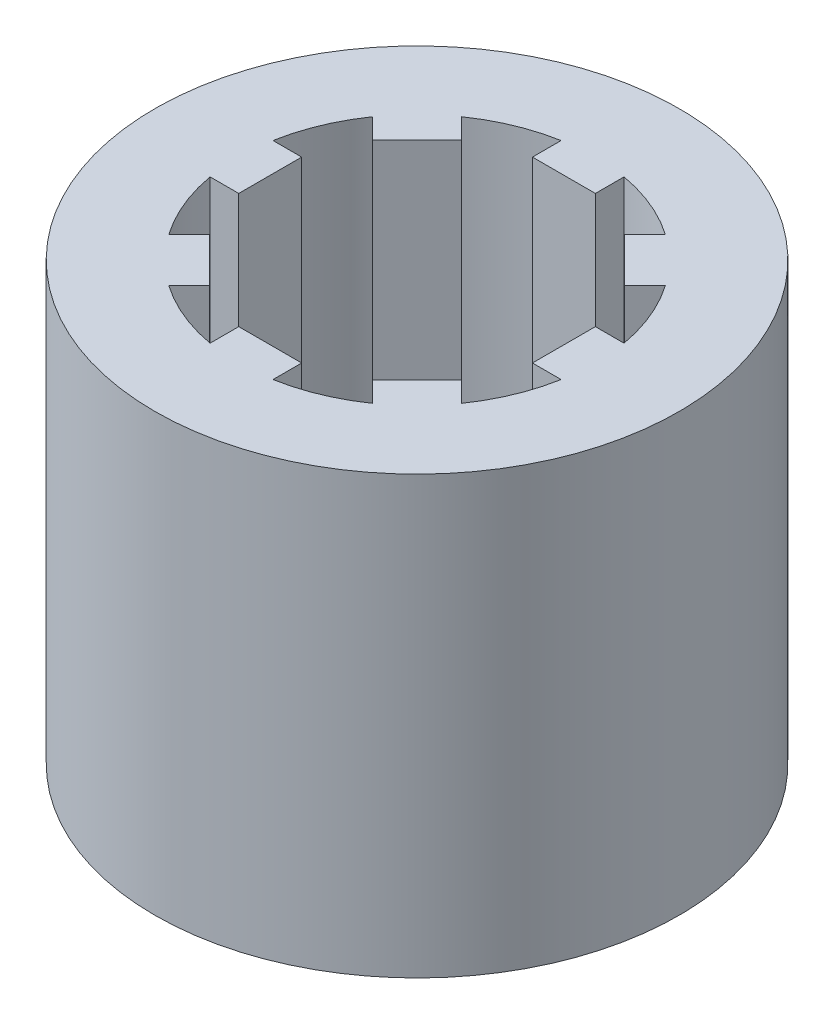
from build123d import *

# Parameters (mm, degrees)
SKETCH3_R           = 19.84375
BOSS_EXTRUDE2_DEPTH = 33.02


with BuildPart() as part:
    # Sketch3 → Boss-Extrude2 (new body)
    with BuildSketch(Plane(origin=(0, 0, 0), x_dir=(1, 0, 0), z_dir=(0, 1, 0))):
        Circle(SKETCH3_R)
        with BuildLine():
            Line((2.38125, 13.281977921), (2.38125, 11.1125))
            Line((2.38125, 11.1125), (-2.38125, 11.1125))
            Line((-2.38125, 11.1125), (-2.38125, 13.281977921))
            ThreePointArc((-2.38125, 13.281977921), (-5.163834565, 12.466599442), (-7.707978633, 11.075574678))
            Line((-7.707978633, 11.075574678), (-6.173926083, 9.541522129))
            Line((-6.173926083, 9.541522129), (-9.541522129, 6.173926083))
            Line((-9.541522129, 6.173926083), (-11.075574678, 7.707978633))
            ThreePointArc((-11.075574678, 7.707978633), (-12.466599442, 5.163834565), (-13.281977921, 2.38125))
            Line((-13.281977921, 2.38125), (-11.1125, 2.38125))
            Line((-11.1125, 2.38125), (-11.1125, -2.38125))
            Line((-11.1125, -2.38125), (-13.281977921, -2.38125))
            ThreePointArc((-13.281977921, -2.38125), (-12.466599442, -5.163834565), (-11.075574678, -7.707978633))
            Line((-11.075574678, -7.707978633), (-9.541522129, -6.173926083))
            Line((-9.541522129, -6.173926083), (-6.173926083, -9.541522129))
            Line((-6.173926083, -9.541522129), (-7.707978633, -11.075574678))
            ThreePointArc((-7.707978633, -11.075574678), (-5.163834565, -12.466599442), (-2.38125, -13.281977921))
            Line((-2.38125, -13.281977921), (-2.38125, -11.1125))
            Line((-2.38125, -11.1125), (2.38125, -11.1125))
            Line((2.38125, -11.1125), (2.38125, -13.281977921))
            ThreePointArc((2.38125, -13.281977921), (5.163834565, -12.466599442), (7.707978633, -11.075574678))
            Line((7.707978633, -11.075574678), (6.173926083, -9.541522129))
            Line((6.173926083, -9.541522129), (9.541522129, -6.173926083))
            Line((9.541522129, -6.173926083), (11.075574678, -7.707978633))
            ThreePointArc((11.075574678, -7.707978633), (12.466599442, -5.163834565), (13.281977921, -2.38125))
            Line((13.281977921, -2.38125), (11.1125, -2.38125))
            Line((11.1125, -2.38125), (11.1125, 2.38125))
            Line((11.1125, 2.38125), (13.281977921, 2.38125))
            ThreePointArc((13.281977921, 2.38125), (12.466599442, 5.163834565), (11.075574678, 7.707978633))
            Line((11.075574678, 7.707978633), (9.541522129, 6.173926083))
            Line((9.541522129, 6.173926083), (6.173926083, 9.541522129))
            Line((6.173926083, 9.541522129), (7.707978633, 11.075574678))
            ThreePointArc((7.707978633, 11.075574678), (5.163834565, 12.466599442), (2.38125, 13.281977921))
        make_face(mode=Mode.SUBTRACT)
    extrude(amount=BOSS_EXTRUDE2_DEPTH)


solid = part.part
